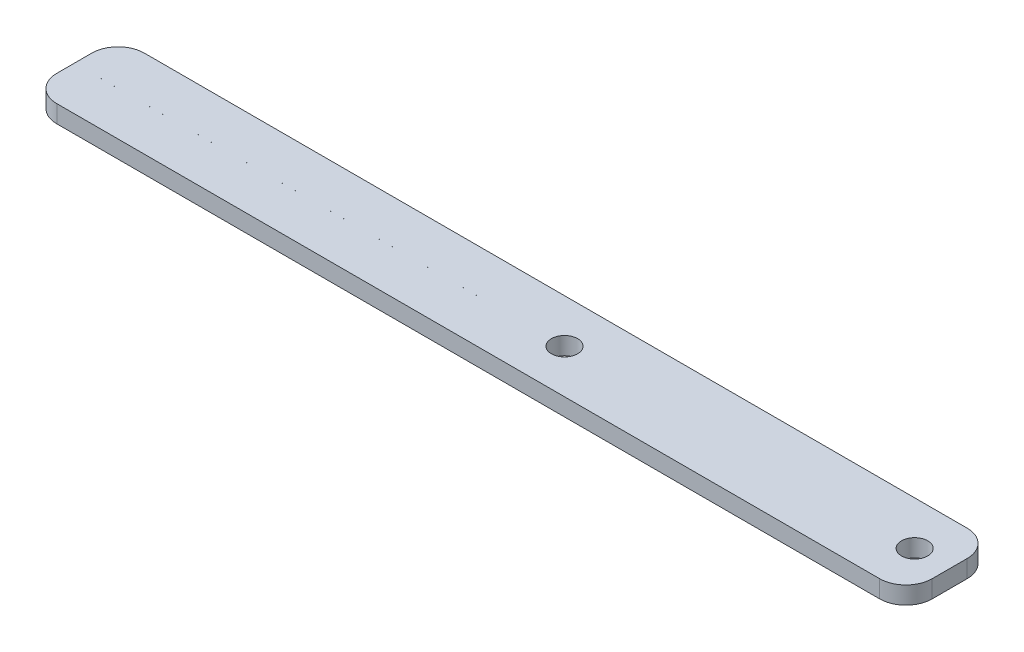
from build123d import *

# Parameters (mm, degrees)
SKETCH1_W             = 100
SKETCH1_H             = 10
BOSS_EXTRUDE1_DEPTH   = 2
FILLET1_R             = 3
F_3_0MM_DOWEL_HOLE1_D = 3
SKETCH2_W             = 47
SKETCH2_H             = 0.001
CUT_EXTRUDE1_DEPTH    = 10


with BuildPart() as part:
    # Sketch1 → Boss-Extrude1 (new body)
    with BuildSketch(Plane(origin=(0, 0, 0), x_dir=(1, 0, 0), z_dir=(0, 1, 0))):
        Rectangle(SKETCH1_W, SKETCH1_H)
    extrude(amount=BOSS_EXTRUDE1_DEPTH)

    # Fillet1
    fillet1_edges = [part.edges().sort_by_distance(p)[0] for p in [
        (50, 1, 5),
        (50, 1, -5),
        (-50, 1, -5),
        (-50, 1, 5),
    ]]
    fillet(fillet1_edges, radius=FILLET1_R)

    # Ø3.0mm Dowel Hole1 (through all)
    with Locations(Plane(origin=(0, 2, 0), x_dir=(1, 0, 0), z_dir=(0, 1, 0))):
        with Locations((46, 0), (6, 0)):
            Hole(F_3_0MM_DOWEL_HOLE1_D / 2)

    # Sketch2 → Cut-Extrude1 (cut)
    with BuildSketch(Plane(origin=(0, 2, 0), x_dir=(1, 0, 0), z_dir=(0, 1, 0))):
        with Locations((-26.5, 0)):
            Rectangle(SKETCH2_W, SKETCH2_H)
    extrude(amount=-CUT_EXTRUDE1_DEPTH, mode=Mode.SUBTRACT)


solid = part.part
